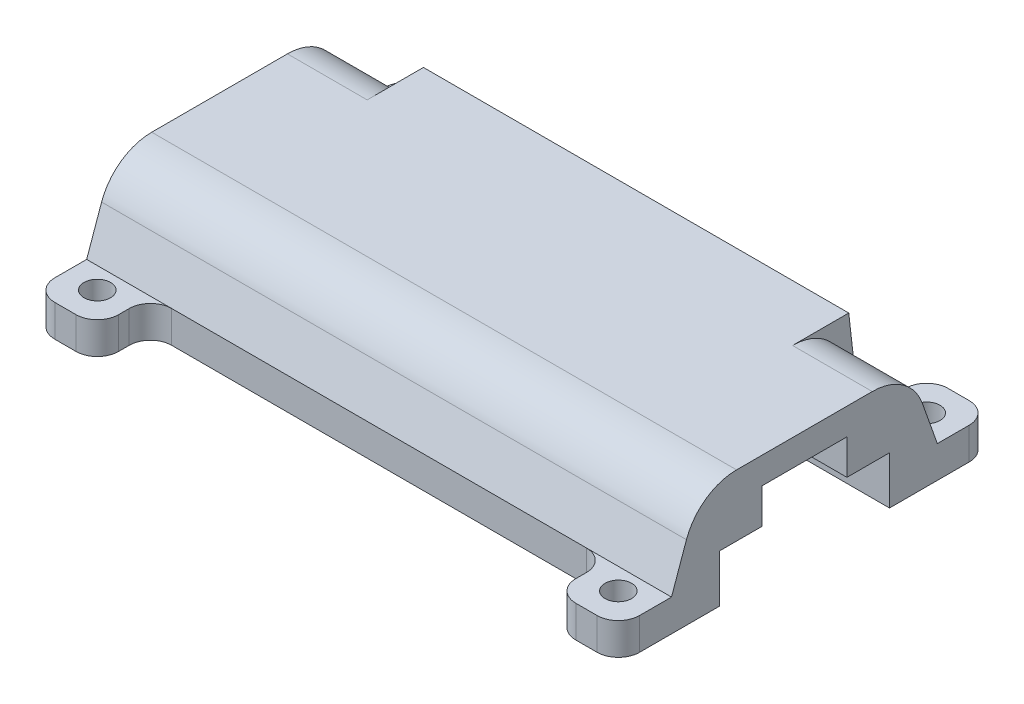
from build123d import *

# Parameters (mm, degrees)
BOSS_EXTRUDE1_DEPTH = 55
FILLET2_R           = 5
SKETCH2_W           = 6
SKETCH2_H           = 5
BOSS_EXTRUDE2_DEPTH = 3
FILLET3_R           = 2
SKETCH3_R           = 1.25
CUT_EXTRUDE1_DEPTH  = 3
SKETCH5_W           = 17.2
SKETCH5_H           = 7
BOSS_EXTRUDE4_DEPTH = 3
BOSS_EXTRUDE5_START = 7.5
BOSS_EXTRUDE5_DEPTH = 40
SKETCH7_W           = 63.002691758
SKETCH7_H           = 45.786839941
CUT_EXTRUDE2_DEPTH  = 10
FILLET5_R           = 2.5


# Read off the part's stored shape, not the designer's step: Boss-Extrude5
with BuildPart() as part:
    # Sketch1 → Boss-Extrude1 (new body)
    with BuildSketch(Plane(origin=(0, 0, 0), x_dir=(0, 0, -1), z_dir=(1, 0, 0))):
        Polygon((10.162208757, 0), (10.162208757, 4.5), (6.162208757, 4.5), (6.162208757, 7.8), (-1.837791243, 7.8), (-1.837791243, 4.5), (-5.837791243, 4.5), (-5.837791243, 0), (-10.337791243, 0), (-10.337791243, 3), (-7.753679525, 10.3), (12.078097038, 10.3), (14.662208757, 3), (14.662208757, 0), align=None)
    extrude(amount=BOSS_EXTRUDE1_DEPTH)

    # Fillet2
    fillet2_edges = [part.edges().sort_by_distance(p)[0] for p in [
        (27.5, 10.3, 7.753679525),
        (27.5, 10.3, -12.078097038),
    ]]
    fillet(fillet2_edges, radius=FILLET2_R)

    # Sketch2 → Boss-Extrude2 (add)
    with BuildSketch(Plane.XZ):
        with Locations((3, 12.837791243)):
            Rectangle(SKETCH2_W, SKETCH2_H)
        with Locations((52, 12.837791243)):
            Rectangle(SKETCH2_W, SKETCH2_H)
        with Locations((52, -17.162208757)):
            Rectangle(SKETCH2_W, SKETCH2_H)
        with Locations((3, -17.162208757)):
            Rectangle(SKETCH2_W, SKETCH2_H)
    extrude(amount=-BOSS_EXTRUDE2_DEPTH)

    # Fillet3
    fillet3_edges = [part.edges().sort_by_distance(p)[0] for p in [
        (0, 1.5, 15.337791243),
        (6, 1.5, 15.337791243),
        (6, 1.5, 10.337791243),
        (55, 1.5, 15.337791243),
        (49, 1.5, 10.337791243),
        (49, 1.5, 15.337791243),
        (55, 1.5, -19.662208757),
        (49, 1.5, -19.662208757),
        (49, 1.5, -14.662208757),
        (0, 1.5, -19.662208757),
        (6, 1.5, -14.662208757),
        (6, 1.5, -19.662208757),
    ]]
    fillet(fillet3_edges, radius=FILLET3_R)

    # Sketch3 → Cut-Extrude1 (cut)
    with BuildSketch(Plane(origin=(0, 3, 0), x_dir=(1, 0, 0), z_dir=(0, 1, 0))):
        with Locations(Location((3, -12.337791243, 0), (0, 0, 270))):
            Circle(SKETCH3_R)
        with Locations(Location((3, 16.662208757, 0), (0, 0, 270))):
            Circle(SKETCH3_R)
        with Locations(Location((52, 16.662208757, 0), (0, 0, 270))):
            Circle(SKETCH3_R)
        with Locations(Location((52, -12.337791243, 0), (0, 0, 270))):
            Circle(SKETCH3_R)
    extrude(amount=-CUT_EXTRUDE1_DEPTH, mode=Mode.SUBTRACT)

    # Sketch5 → Boss-Extrude4 (add)
    with BuildSketch(Plane.XZ):
        with Locations((27.5, -9.662208757)):
            Rectangle(SKETCH5_W, SKETCH5_H)
    extrude(amount=BOSS_EXTRUDE4_DEPTH)

    # Boss-Extrude5 outline → Boss-Extrude5 (add)
    with BuildSketch(Plane.YZ.offset(BOSS_EXTRUDE5_START)):
        with BuildLine():
            Line((6.96848703, -13.257412341), (3, -14.662208757))
            Line((3, -14.662208757), (11.563888282, -13.687484192))
            Line((11.563888282, -13.687484192), (10.3, -2.583015869))
            Line((10.3, -2.583015869), (10.3, -8.544011124))
            ThreePointArc((10.3, -8.544011124), (9.383040237, -11.429974122), (6.96848703, -13.257412341))
        make_face()
        Polygon((0, -14.662208757), (0.038366584, -14.999295924), (3, -14.662208757), align=None)
    extrude(amount=BOSS_EXTRUDE5_DEPTH)

    # Sketch7 → Cut-Extrude2 (cut)
    with BuildSketch(Plane(origin=(0, 10.3, 0), x_dir=(1, 0, 0), z_dir=(0, 1, 0))):
        with Locations((26.50814736, 1.093849158)):
            Rectangle(SKETCH7_W, SKETCH7_H)
    extrude(amount=CUT_EXTRUDE2_DEPTH, mode=Mode.SUBTRACT)

    # Fillet5
    fillet5_edges = [part.edges().sort_by_distance(p)[0] for p in [
        (27.5, 0, -6.162208757),
    ]]
    fillet(fillet5_edges, radius=FILLET5_R)


solid = part.part
